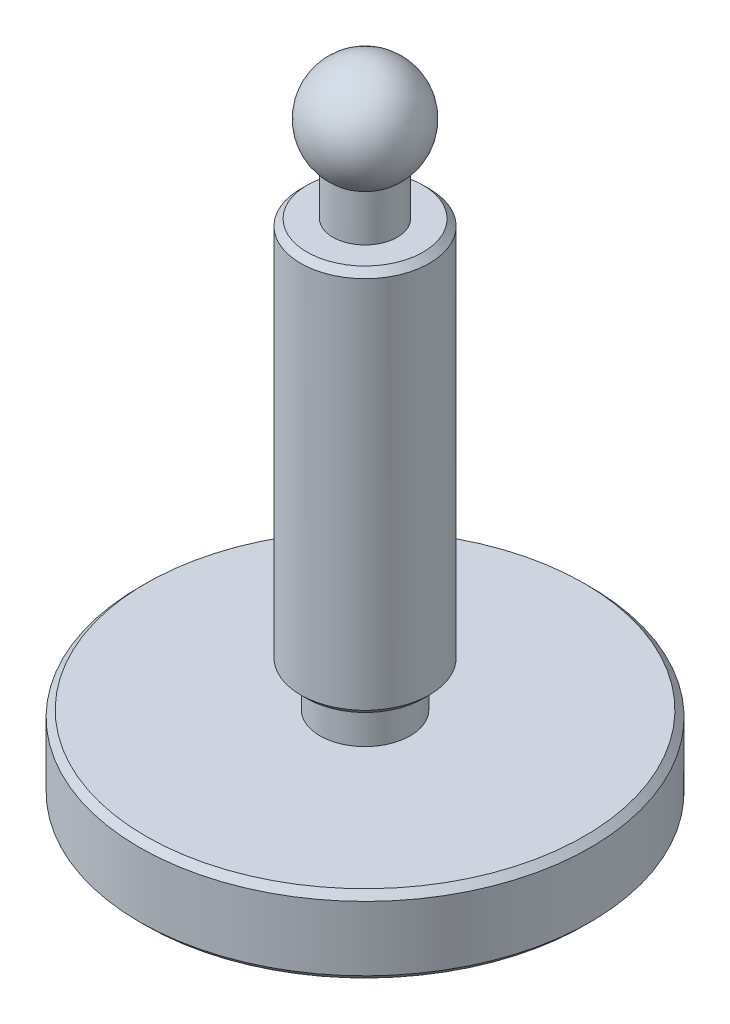
from build123d import *

# Parameters (mm, degrees)
SKETCH1_R                = 17.5
BOSS_EXTRUDE1_DEPTH      = 6
CHAMFER1_SIZE            = 0.5
MOVE_START               = 6
MOVE_FACE1_OUTLINE_R     = 3.5
MOVE_FACE1_OUTLINE_R_2   = 2.5
MOVE_FACE1_DEPTH         = 3
MOVE_START_2             = 39
MOVE_FACE1_2_OUTLINE_R   = 2.5
MOVE_FACE1_2_OUTLINE_R_2 = 1.5
MOVE_FACE1_2_DEPTH       = 3.585600344
CHAMFER3_SIZE            = 0.5


# Read off the part's stored shape, not the designer's step: Move Face1
with BuildPart() as part:
    # Sketch1 → Boss-Extrude1 (new body)
    with BuildSketch(Plane(origin=(0, 0, 0), x_dir=(1, 0, 0), z_dir=(0, 1, 0))):
        with Locations(Location((0, 0, 0), (0, 0, 270))):
            Circle(SKETCH1_R)
    extrude(amount=BOSS_EXTRUDE1_DEPTH)

    # Chamfer1
    chamfer1_edges = [part.edges().sort_by_distance(p)[0] for p in [
        (0, 0, -17.5),
        (0, 6, -17.5),
    ]]
    chamfer(chamfer1_edges, length=CHAMFER1_SIZE)

    # Sketch3 → Revolve3 (revolve)
    with BuildSketch(Plane.XY, mode=Mode.PRIVATE) as revolve3_sk:
        with BuildLine():
            Line((-2.5, 6), (-2.5, 9))
            Line((-2.5, 9), (-5, 9))
            Line((-5, 9), (-5, 39))
            Line((-5, 39), (-1.5, 39))
            Line((-1.5, 39), (-1.5, 42))
            ThreePointArc((-1.5, 42), (-3.92634671, 46.472168293), (0, 49.708099244))
            Line((0, 49.708099244), (0, 6))
            Line((0, 6), (-2.5, 6))
        make_face()
    revolve(revolve3_sk.sketch.rotate(Axis((0, 0, 0), (0, 1, 0)), 270), axis=Axis((0, 0, 0), (0, 1, 0)))

    # Move Face1 outline → Move Face1 (add)
    with BuildSketch(Plane(origin=(0, 0, 0), x_dir=(1, 0, 0), z_dir=(0, 1, 0)).offset(MOVE_START)):
        Circle(MOVE_FACE1_OUTLINE_R)
        Circle(MOVE_FACE1_OUTLINE_R_2, mode=Mode.SUBTRACT)
    extrude(amount=MOVE_FACE1_DEPTH)

    # Move Face1 2 outline → Move Face1 2 (add)
    with BuildSketch(Plane(origin=(0, 0, 0), x_dir=(1, 0, 0), z_dir=(0, 1, 0)).offset(MOVE_START_2)):
        Circle(MOVE_FACE1_2_OUTLINE_R)
        Circle(MOVE_FACE1_2_OUTLINE_R_2, mode=Mode.SUBTRACT)
    extrude(amount=MOVE_FACE1_2_DEPTH)

    # Chamfer3
    chamfer3_edges = [part.edges().sort_by_distance(p)[0] for p in [
        (0, 39, 5),
        (0, 9, 5),
    ]]
    chamfer(chamfer3_edges, length=CHAMFER3_SIZE)


solid = part.part
